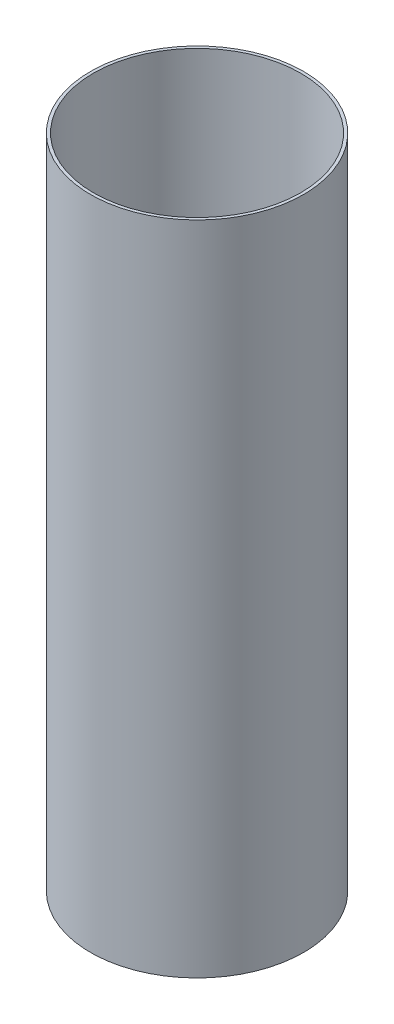
from build123d import *

# Parameters (mm, degrees)
SKETCH1_R           = 78.359
SKETCH1_R_2         = 76.2
BOSS_EXTRUDE1_DEPTH = 482.6


with BuildPart() as part:
    # Sketch1 → Boss-Extrude1 (new body)
    with BuildSketch(Plane(origin=(0, 0, 0), x_dir=(1, 0, 0), z_dir=(0, 1, 0))):
        Circle(SKETCH1_R)
        Circle(SKETCH1_R_2, mode=Mode.SUBTRACT)
    extrude(amount=BOSS_EXTRUDE1_DEPTH)


solid = part.part
